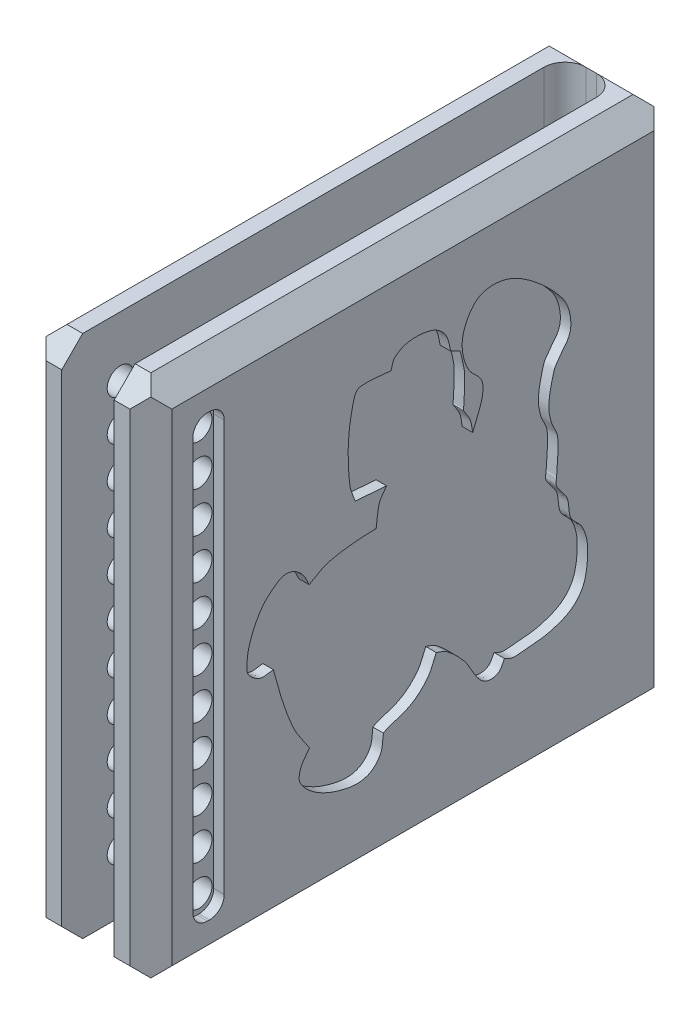
from build123d import *

# Parameters (mm, degrees)
SKETCH1_W                = 6
SKETCH1_H                = 25
BOSS_EXTRUDE1_DEPTH      = 25
SKETCH2_W                = 2.5
SKETCH2_H                = 25
CUT_EXTRUDE1_DEPTH       = 24
FILLET2_R                = 1
CHAMFER1_SIZE            = 1
CHAMFER2_SIZE            = 1
CHAMFER3_SIZE            = 1
CHAMFER4_SIZE            = 1
CUT_EXTRUDE2_DEPTH       = 0.5
CUT_EXTRUDE3_REACH       = 30.487
SKETCH4_R                = 0.625
LPATTERN1_COUNT          = 6
LPATTERN1_PITCH          = 1.93
LPATTERN1_COL_COUNT      = 6
LPATTERN1_COL_PITCH      = 1.93
MIRROR1_COPY_1_REACH     = 30.487
MIRROR1_COPY_1_SKETCH_R  = 0.625
MIRROR1_COPY_2_REACH     = 30.487
MIRROR1_COPY_2_SKETCH_R  = 0.625
MIRROR1_COPY_3_REACH     = 30.487
MIRROR1_COPY_3_SKETCH_R  = 0.625
MIRROR1_COPY_4_REACH     = 30.487
MIRROR1_COPY_4_SKETCH_R  = 0.625
MIRROR1_COPY_5_REACH     = 30.487
MIRROR1_COPY_5_SKETCH_R  = 0.625
MIRROR1_COPY_6_REACH     = 30.487
MIRROR1_COPY_6_SKETCH_R  = 0.625
MIRROR1_COPY_7_REACH     = 30.487
MIRROR1_COPY_7_SKETCH_R  = 0.625
MIRROR1_COPY_8_REACH     = 30.487
MIRROR1_COPY_8_SKETCH_R  = 0.625
MIRROR1_COPY_9_REACH     = 30.487
MIRROR1_COPY_9_SKETCH_R  = 0.625
MIRROR1_COPY_10_REACH    = 30.487
MIRROR1_COPY_10_SKETCH_R = 0.625
CUT_EXTRUDE4_START       = 3
CUT_EXTRUDE4_DEPTH       = 0.5
SKETCH7_W                = 1
SKETCH7_H                = 15
CUT_EXTRUDE5_DEPTH       = 0.5
LPATTERN2_COUNT          = 7
LPATTERN2_PITCH          = 2


with BuildPart() as part:
    # Sketch1 → Boss-Extrude1 (new body)
    with BuildSketch(Plane.XY):
        Rectangle(SKETCH1_W, SKETCH1_H)
    extrude(amount=BOSS_EXTRUDE1_DEPTH)

    # Sketch2 → Cut-Extrude1 (cut)
    with BuildSketch(Plane.XY.offset(25)):
        Rectangle(SKETCH2_W, SKETCH2_H)
    extrude(amount=-CUT_EXTRUDE1_DEPTH, mode=Mode.SUBTRACT)

    # Fillet2
    fillet2_edges = [part.edges().sort_by_distance(p)[0] for p in [
        (-1.25, 0, 1),
        (1.25, 0, 1),
    ]]
    fillet(fillet2_edges, radius=FILLET2_R)

    # Chamfer1
    chamfer1_edges = [part.edges().sort_by_distance(p)[0] for p in [
        (3, 0, 25),
        (-3, 0, 25),
        (-3, 12.5, 12.5),
        (-3, -12.5, 12.5),
    ]]
    chamfer(chamfer1_edges, length=CHAMFER1_SIZE)

    # Chamfer2
    chamfer2_edges = [part.edges().sort_by_distance(p)[0] for p in [
        (-3, 0, 0),
        (3, -12.5, 12),
        (3, 12.5, 12),
        (3, 0, 0),
    ]]
    chamfer(chamfer2_edges, length=CHAMFER2_SIZE)

    # Chamfer3
    chamfer3_edges = [part.edges().sort_by_distance(p)[0] for p in [
        (0, -12.5, 0),
        (0, 12.5, 0),
    ]]
    chamfer(chamfer3_edges, length=CHAMFER3_SIZE - 0.0001)  # a hair under: the kernel refuses the full size

    # Chamfer4
    chamfer4_edges = [part.edges().sort_by_distance(p)[0] for p in [
        (1.625, -12.5, 25),
        (-1.625, 12.5, 25),
        (1.625, 12.5, 25),
        (-1.625, -12.5, 25),
    ]]
    chamfer(chamfer4_edges, length=CHAMFER4_SIZE)

    # Sketch3 → Cut-Extrude2 (cut)
    with BuildSketch(Plane.ZY.offset(3)):
        with BuildLine():
            Line((22.3, 10.5), (22.2, 10.5))
            ThreePointArc((22.2, 10.5), (21.705025253, 10.294974747), (21.5, 9.8))
            Line((21.5, 9.8), (21.5, -9.8))
            ThreePointArc((21.5, -9.8), (21.705025253, -10.294974747), (22.2, -10.5))
            Line((22.2, -10.5), (22.3, -10.5))
            ThreePointArc((22.3, -10.5), (22.794974747, -10.294974747), (23, -9.8))
            Line((23, -9.8), (23, 9.8))
            ThreePointArc((23, 9.8), (22.794974747, 10.294974747), (22.3, 10.5))
        make_face()
    cut_extrude2 = extrude(amount=-CUT_EXTRUDE2_DEPTH, mode=Mode.SUBTRACT)

    # Sketch4 → Cut-Extrude3 (cut, up to next)
    with BuildSketch(Plane.ZY.offset(2.5), mode=Mode.PRIVATE) as cut_extrude3_sk1:
        with Locations((22.206617043, 0)):
            Circle(SKETCH4_R)
    cut_extrude3_tool1 = extrude(cut_extrude3_sk1.sketch, amount=-CUT_EXTRUDE3_REACH, mode=Mode.PRIVATE) & part.part
    cut_extrude3 = cut_extrude3_tool1.solids().sort_by_distance((-2.5, 0, 22.206617))[0]
    add(cut_extrude3, mode=Mode.SUBTRACT)

    # LPattern1: Cut-Extrude3 ×6
    with Locations(*[(0, -i * LPATTERN1_PITCH, 0) for i in range(1, LPATTERN1_COUNT)]):
        add(cut_extrude3, mode=Mode.SUBTRACT)

    # LPattern1 col: Cut-Extrude3 ×6
    with Locations(*[(0, i * LPATTERN1_COL_PITCH, 0) for i in range(1, LPATTERN1_COL_COUNT)]):
        add(cut_extrude3, mode=Mode.SUBTRACT)

    # Mirror1: Cut-Extrude2, Cut-Extrude3 across plane
    add(cut_extrude2.mirror(Plane(origin=(0, 0, 0), x_dir=(0, 0, 1), z_dir=(1, 0, 0))), mode=Mode.SUBTRACT)
    add(cut_extrude3.mirror(Plane(origin=(0, 0, 0), x_dir=(0, 0, 1), z_dir=(1, 0, 0))), mode=Mode.SUBTRACT)

    # Mirror1 copy 1 sketch → Mirror1 copy 1 (cut, up to next)
    with BuildSketch(Plane(origin=(2.5, -1.93, 0), x_dir=(0, 0, 1), z_dir=(1, 0, 0)), mode=Mode.PRIVATE) as mirror1_copy_1_sk1:
        with Locations((22.206617043, 0)):
            Circle(MIRROR1_COPY_1_SKETCH_R)
    mirror1_copy_1_tool1 = extrude(mirror1_copy_1_sk1.sketch, amount=-MIRROR1_COPY_1_REACH, mode=Mode.PRIVATE) & part.part
    add(mirror1_copy_1_tool1.solids().sort_by_distance((2.5, -1.93, 22.206617))[0], mode=Mode.SUBTRACT)

    # Mirror1 copy 2 sketch → Mirror1 copy 2 (cut, up to next)
    with BuildSketch(Plane(origin=(2.5, -3.86, 0), x_dir=(0, 0, 1), z_dir=(1, 0, 0)), mode=Mode.PRIVATE) as mirror1_copy_2_sk1:
        with Locations((22.206617043, 0)):
            Circle(MIRROR1_COPY_2_SKETCH_R)
    mirror1_copy_2_tool1 = extrude(mirror1_copy_2_sk1.sketch, amount=-MIRROR1_COPY_2_REACH, mode=Mode.PRIVATE) & part.part
    add(mirror1_copy_2_tool1.solids().sort_by_distance((2.5, -3.86, 22.206617))[0], mode=Mode.SUBTRACT)

    # Mirror1 copy 3 sketch → Mirror1 copy 3 (cut, up to next)
    with BuildSketch(Plane(origin=(2.5, -5.79, 0), x_dir=(0, 0, 1), z_dir=(1, 0, 0)), mode=Mode.PRIVATE) as mirror1_copy_3_sk1:
        with Locations((22.206617043, 0)):
            Circle(MIRROR1_COPY_3_SKETCH_R)
    mirror1_copy_3_tool1 = extrude(mirror1_copy_3_sk1.sketch, amount=-MIRROR1_COPY_3_REACH, mode=Mode.PRIVATE) & part.part
    add(mirror1_copy_3_tool1.solids().sort_by_distance((2.5, -5.79, 22.206617))[0], mode=Mode.SUBTRACT)

    # Mirror1 copy 4 sketch → Mirror1 copy 4 (cut, up to next)
    with BuildSketch(Plane(origin=(2.5, -7.72, 0), x_dir=(0, 0, 1), z_dir=(1, 0, 0)), mode=Mode.PRIVATE) as mirror1_copy_4_sk1:
        with Locations((22.206617043, 0)):
            Circle(MIRROR1_COPY_4_SKETCH_R)
    mirror1_copy_4_tool1 = extrude(mirror1_copy_4_sk1.sketch, amount=-MIRROR1_COPY_4_REACH, mode=Mode.PRIVATE) & part.part
    add(mirror1_copy_4_tool1.solids().sort_by_distance((2.5, -7.72, 22.206617))[0], mode=Mode.SUBTRACT)

    # Mirror1 copy 5 sketch → Mirror1 copy 5 (cut, up to next)
    with BuildSketch(Plane(origin=(2.5, -9.65, 0), x_dir=(0, 0, 1), z_dir=(1, 0, 0)), mode=Mode.PRIVATE) as mirror1_copy_5_sk1:
        with Locations((22.206617043, 0)):
            Circle(MIRROR1_COPY_5_SKETCH_R)
    mirror1_copy_5_tool1 = extrude(mirror1_copy_5_sk1.sketch, amount=-MIRROR1_COPY_5_REACH, mode=Mode.PRIVATE) & part.part
    add(mirror1_copy_5_tool1.solids().sort_by_distance((2.5, -9.65, 22.206617))[0], mode=Mode.SUBTRACT)

    # Mirror1 copy 6 sketch → Mirror1 copy 6 (cut, up to next)
    with BuildSketch(Plane(origin=(2.5, 1.93, 0), x_dir=(0, 0, 1), z_dir=(1, 0, 0)), mode=Mode.PRIVATE) as mirror1_copy_6_sk1:
        with Locations((22.206617043, 0)):
            Circle(MIRROR1_COPY_6_SKETCH_R)
    mirror1_copy_6_tool1 = extrude(mirror1_copy_6_sk1.sketch, amount=-MIRROR1_COPY_6_REACH, mode=Mode.PRIVATE) & part.part
    add(mirror1_copy_6_tool1.solids().sort_by_distance((2.5, 1.93, 22.206617))[0], mode=Mode.SUBTRACT)

    # Mirror1 copy 7 sketch → Mirror1 copy 7 (cut, up to next)
    with BuildSketch(Plane(origin=(2.5, 3.86, 0), x_dir=(0, 0, 1), z_dir=(1, 0, 0)), mode=Mode.PRIVATE) as mirror1_copy_7_sk1:
        with Locations((22.206617043, 0)):
            Circle(MIRROR1_COPY_7_SKETCH_R)
    mirror1_copy_7_tool1 = extrude(mirror1_copy_7_sk1.sketch, amount=-MIRROR1_COPY_7_REACH, mode=Mode.PRIVATE) & part.part
    add(mirror1_copy_7_tool1.solids().sort_by_distance((2.5, 3.86, 22.206617))[0], mode=Mode.SUBTRACT)

    # Mirror1 copy 8 sketch → Mirror1 copy 8 (cut, up to next)
    with BuildSketch(Plane(origin=(2.5, 5.79, 0), x_dir=(0, 0, 1), z_dir=(1, 0, 0)), mode=Mode.PRIVATE) as mirror1_copy_8_sk1:
        with Locations((22.206617043, 0)):
            Circle(MIRROR1_COPY_8_SKETCH_R)
    mirror1_copy_8_tool1 = extrude(mirror1_copy_8_sk1.sketch, amount=-MIRROR1_COPY_8_REACH, mode=Mode.PRIVATE) & part.part
    add(mirror1_copy_8_tool1.solids().sort_by_distance((2.5, 5.79, 22.206617))[0], mode=Mode.SUBTRACT)

    # Mirror1 copy 9 sketch → Mirror1 copy 9 (cut, up to next)
    with BuildSketch(Plane(origin=(2.5, 7.72, 0), x_dir=(0, 0, 1), z_dir=(1, 0, 0)), mode=Mode.PRIVATE) as mirror1_copy_9_sk1:
        with Locations((22.206617043, 0)):
            Circle(MIRROR1_COPY_9_SKETCH_R)
    mirror1_copy_9_tool1 = extrude(mirror1_copy_9_sk1.sketch, amount=-MIRROR1_COPY_9_REACH, mode=Mode.PRIVATE) & part.part
    add(mirror1_copy_9_tool1.solids().sort_by_distance((2.5, 7.72, 22.206617))[0], mode=Mode.SUBTRACT)

    # Mirror1 copy 10 sketch → Mirror1 copy 10 (cut, up to next)
    with BuildSketch(Plane(origin=(2.5, 9.65, 0), x_dir=(0, 0, 1), z_dir=(1, 0, 0)), mode=Mode.PRIVATE) as mirror1_copy_10_sk1:
        with Locations((22.206617043, 0)):
            Circle(MIRROR1_COPY_10_SKETCH_R)
    mirror1_copy_10_tool1 = extrude(mirror1_copy_10_sk1.sketch, amount=-MIRROR1_COPY_10_REACH, mode=Mode.PRIVATE) & part.part
    add(mirror1_copy_10_tool1.solids().sort_by_distance((2.5, 9.65, 22.206617))[0], mode=Mode.SUBTRACT)

    # Sketch6 → Cut-Extrude4 (cut)
    with BuildSketch(Plane(origin=(0, 0, 0), x_dir=(0, 0, -1), z_dir=(1, 0, 0)).offset(CUT_EXTRUDE4_START)):
        with BuildLine():
            Line((-13.75659598, 3.208094703), (-15.25659598, 3.328094703))
            add(Edge.make_bspline(
                [(-15.25659598, 3.328094703), (-15.34159598, 3.598094703), (-15.478059231, 3.857024807), (-15.51159598, 4.138094703), (-15.583906266, 4.744123764), (-15.610639421, 5.359017032), (-15.57159598, 5.968094703), (-15.535260245, 6.534932171), (-15.444836525, 7.102581248), (-15.28659598, 7.648094703), (-15.249167055, 7.777126), (-15.134978357, 7.91699683), (-15.00159598, 7.933094703), (-14.519450844, 7.991284633), (-14.03159598, 7.883094703), (-13.54659598, 7.858094703)],
                knots=[0, 0, 0, 0, 1, 1, 1, 2, 2, 2, 3, 3, 3, 4, 4, 4, 5, 5, 5, 5], degree=3))
            add(Edge.make_bspline(
                [(-13.54659598, 7.858094703), (-13.48159598, 8.013094703), (-13.476741249, 8.210895497), (-13.35159598, 8.323094703), (-13.166723721, 8.488842246), (-12.922480212, 8.603584636), (-12.67659598, 8.638094703), (-12.334048727, 8.686171511), (-11.974306488, 8.657718792), (-11.64159598, 8.563094703), (-11.412157478, 8.497841551), (-11.197922131, 8.353267216), (-11.04159598, 8.173094703), (-10.804491339, 7.899821558), (-10.762009421, 7.570161907), (-10.69659598, 7.243094703)],
                knots=[0, 0, 0, 0, 1, 1, 1, 2, 2, 2, 3, 3, 3, 4, 4, 4, 5, 5, 5, 5], degree=3))
            Line((-10.69659598, 7.243094703), (-10.24659598, 7.033094703))
            add(Edge.make_bspline(
                [(-10.24659598, 7.033094703), (-10.17659598, 6.693094703), (-10.059548306, 6.359466167), (-10.03659598, 6.013094703), (-10.004181978, 5.523937947), (-10.062196157, 5.032940237), (-10.08159598, 4.543094703), (-10.082221683, 4.5272957), (-10.10394565, 4.512094073), (-10.09659598, 4.498094703), (-9.99654865, 4.307528359), (-9.845622127, 4.143294274), (-9.76659598, 3.943094703), (-9.693507703, 3.757937733), (-9.68659598, 3.553094703), (-9.64659598, 3.358094703)],
                knots=[0, 0, 0, 0, 1, 1, 1, 2, 2, 2, 3, 3, 3, 4, 4, 4, 5, 5, 5, 5], degree=3))
            add(Edge.make_bspline(
                [(-9.64659598, 3.358094703), (-9.49659598, 3.768094703), (-9.288520046, 4.161304396), (-9.19659598, 4.588094703), (-9.146018675, 4.822917905), (-9.129038173, 5.088589637), (-9.22659598, 5.308094703), (-9.360760059, 5.60996388), (-9.700743832, 5.781830033), (-9.85659598, 6.073094703), (-10.011822034, 6.363189295), (-10.108585544, 6.690741208), (-10.14159598, 7.018094703), (-10.169907425, 7.298849867), (-10.138982996, 7.595146231), (-10.03659598, 7.858094703), (-9.913309024, 8.174718023), (-9.742862161, 8.495862148), (-9.48159598, 8.713094703), (-9.271261927, 8.887979197), (-8.975049206, 8.961142503), (-8.70159598, 8.968094703), (-8.364362395, 8.976668438), (-8.017342873, 8.900638863), (-7.71159598, 8.758094703), (-7.264149639, 8.549487963), (-6.857104165, 8.253592134), (-6.48159598, 7.933094703), (-6.067318292, 7.579507377), (-5.679685309, 7.186573078), (-5.35659598, 6.748094703), (-5.182509496, 6.511834474), (-5.069657746, 6.22576436), (-5.01159598, 5.938094703), (-4.957179545, 5.668486002), (-4.938146197, 5.373530177), (-5.02659598, 5.113094703), (-5.126052852, 4.82024947), (-5.382439364, 4.607007892), (-5.55159598, 4.348094703), (-5.627580506, 4.231791858), (-5.72326723, 4.121627122), (-5.76159598, 3.988094703), (-5.879821683, 3.576211609), (-5.985172366, 3.155455858), (-6.01659598, 2.728094703), (-6.035834132, 2.466455842), (-5.979192538, 2.201581794), (-5.91159598, 1.948094703), (-5.838150825, 1.67267537), (-5.628462394, 1.43635171), (-5.59659598, 1.153094703), (-5.536762273, 0.621239528), (-5.622321636, 0.082957769), (-5.64159598, -0.451905297), (-5.6423384, -0.472507452), (-5.65659598, -0.491289769), (-5.65659598, -0.511905297), (-5.65659598, -0.632009418), (-5.692304606, -0.763030895), (-5.64159598, -0.871905297), (-5.51688444, -1.139668311), (-5.2593142, -1.333876721), (-5.14659598, -1.606905297), (-5.029848014, -1.889694816), (-5.095826647, -2.229597824), (-4.96659598, -2.506905297), (-4.848153364, -2.76106341), (-4.555883166, -2.903088449), (-4.42659598, -3.151905297), (-4.285044038, -3.424326015), (-4.192864316, -3.730641264), (-4.17159598, -4.036905297), (-4.142053328, -4.462319485), (-4.174624176, -4.89783797), (-4.27659598, -5.311905297), (-4.342917918, -5.581212557), (-4.479525035, -5.842138451), (-4.66659598, -6.046905297), (-4.861147332, -6.259860155), (-5.118927955, -6.419416562), (-5.38659598, -6.526905297), (-5.763597062, -6.678299432), (-6.166720467, -6.778352077), (-6.57159598, -6.811905297), (-7.789953763, -6.912874174), (-7.65215886, -6.976623857), (-8.13159598, -6.736905297)],
                knots=[0, 0, 0, 0, 1, 1, 1, 2, 2, 2, 3, 3, 3, 4, 4, 4, 5, 5, 5, 6, 6, 6, 7, 7, 7, 8, 8, 8, 9, 9, 9, 10, 10, 10, 11, 11, 11, 12, 12, 12, 13, 13, 13, 14, 14, 14, 15, 15, 15, 16, 16, 16, 17, 17, 17, 18, 18, 18, 19, 19, 19, 20, 20, 20, 21, 21, 21, 22, 22, 22, 23, 23, 23, 24, 24, 24, 25, 25, 25, 26, 26, 26, 27, 27, 27, 28, 28, 28, 29, 29, 29, 29], degree=3))
            add(Edge.make_bspline(
                [(-8.13159598, -6.736905297), (-8.22159598, -6.876905297), (-8.26436961, -7.062730336), (-8.40159598, -7.156905297), (-8.540667701, -7.252346674), (-8.730903679, -7.293465735), (-8.89659598, -7.261905297), (-9.071012952, -7.228683016), (-9.23263856, -7.113062215), (-9.34659598, -6.976905297), (-9.625216523, -6.644008025), (-9.778150445, -6.219066296), (-10.05159598, -5.881905297), (-10.29661073, -5.579799732), (-10.582513679, -5.308058067), (-10.89159598, -5.071905297), (-11.034017705, -4.963088698), (-11.22159598, -4.931905297), (-11.38659598, -4.861905297)],
                knots=[0, 0, 0, 0, 1, 1, 1, 2, 2, 2, 3, 3, 3, 4, 4, 4, 5, 5, 5, 6, 6, 6, 6], degree=3))
            add(Edge.make_bspline(
                [(-11.38659598, -4.861905297), (-11.51659598, -5.131905297), (-11.594914061, -5.433595246), (-11.77659598, -5.671905297), (-11.986836337, -5.947675115), (-12.243642088, -6.199497636), (-12.54159598, -6.376905297), (-12.910187156, -6.596371798), (-13.344206699, -6.680329435), (-13.74159598, -6.841905297), (-13.799631993, -6.865502357), (-13.85159598, -6.901905297), (-13.90659598, -6.931905297)],
                knots=[0, 0, 0, 0, 1, 1, 1, 2, 2, 2, 3, 3, 3, 4, 4, 4, 4], degree=3))
            add(Edge.make_bspline(
                [(-13.90659598, -6.931905297), (-13.95659598, -7.201905297), (-13.926412623, -7.500136205), (-14.05659598, -7.741905297), (-14.184030979, -7.978570294), (-14.392540831, -8.195803702), (-14.64159598, -8.296905297), (-14.929428763, -8.413748308), (-15.26647199, -8.415209244), (-15.57159598, -8.356905297), (-16.067135074, -8.262216298), (-16.56050565, -8.100578757), (-16.99659598, -7.846905297), (-17.342055911, -7.645951481), (-17.662556052, -7.365551492), (-17.86659598, -7.021905297), (-17.971287551, -6.845582652), (-17.919234057, -6.600490138), (-17.85159598, -6.406905297), (-17.768347183, -6.168641498), (-17.57159598, -5.986905297), (-17.43159598, -5.776905297)],
                knots=[0, 0, 0, 0, 1, 1, 1, 2, 2, 2, 3, 3, 3, 4, 4, 4, 5, 5, 5, 6, 6, 6, 7, 7, 7, 7], degree=3))
            add(Edge.make_bspline(
                [(-17.43159598, -5.776905297), (-17.68659598, -5.376905297), (-17.996656257, -5.007078642), (-18.19659598, -4.576905297), (-18.625110168, -3.65495053), (-18.894637192, -2.664250752), (-19.15659598, -1.681905297)],
                knots=[0, 0, 0, 0, 1, 1, 1, 2, 2, 2, 2], degree=3))
            add(Edge.make_bspline(
                [(-19.15659598, -1.681905297), (-19.36159598, -1.696905297), (-19.57154848, -1.774138734), (-19.77159598, -1.726905297), (-19.95111846, -1.684518045), (-20.106164006, -1.557337271), (-20.23659598, -1.426905297), (-20.328315662, -1.335185615), (-20.412413923, -1.21154908), (-20.41659598, -1.081905297), (-20.42797332, -0.729207755), (-20.389799692, -0.367787652), (-20.28159598, -0.031905297), (-20.146522308, 0.387385894), (-19.953456189, 0.795222053), (-19.69659598, 1.153094703), (-19.500477146, 1.426338922), (-19.224266505, 1.638294598), (-18.94659598, 1.828094703), (-18.82125706, 1.913769408), (-18.663240825, 1.970432357), (-18.51159598, 1.963094703), (-18.336230654, 1.954609284), (-18.156508924, 1.889157741), (-18.01659598, 1.783094703), (-17.681073904, 1.528747323), (-17.601852143, 1.300857713), (-17.44659598, 0.973094703)],
                knots=[0, 0, 0, 0, 1, 1, 1, 2, 2, 2, 3, 3, 3, 4, 4, 4, 5, 5, 5, 6, 6, 6, 7, 7, 7, 8, 8, 8, 9, 9, 9, 9], degree=3))
            add(Edge.make_bspline(
                [(-17.44659598, 0.973094703), (-17.14159598, 1.128094703), (-16.862138601, 1.349824799), (-16.53159598, 1.438094703), (-15.792748628, 1.63540053), (-15.016055345, 1.672433639), (-14.25159598, 1.693094703)],
                knots=[0, 0, 0, 0, 1, 1, 1, 2, 2, 2, 2], degree=3))
            add(Edge.make_bspline(
                [(-14.25159598, 1.693094703), (-14.20159598, 2.018094703), (-14.203720501, 2.355531778), (-14.10159598, 2.668094703), (-14.035257059, 2.871132009), (-13.87159598, 3.028094703), (-13.75659598, 3.208094703)],
                knots=[0, 0, 0, 0, 1, 1, 1, 2, 2, 2, 2], degree=3))
        make_face()
    extrude(amount=-CUT_EXTRUDE4_DEPTH, mode=Mode.SUBTRACT)

    # Sketch7 → Cut-Extrude5 (cut)
    with BuildSketch(Plane.ZY.offset(3)):
        with Locations((5.5, 0)):
            Rectangle(SKETCH7_W, SKETCH7_H)
    cut_extrude5 = extrude(amount=-CUT_EXTRUDE5_DEPTH, mode=Mode.SUBTRACT)

    # LPattern2: Cut-Extrude5 ×7
    with Locations(*[(0, 0, i * LPATTERN2_PITCH) for i in range(1, LPATTERN2_COUNT)]):
        add(cut_extrude5, mode=Mode.SUBTRACT)


solid = part.part
